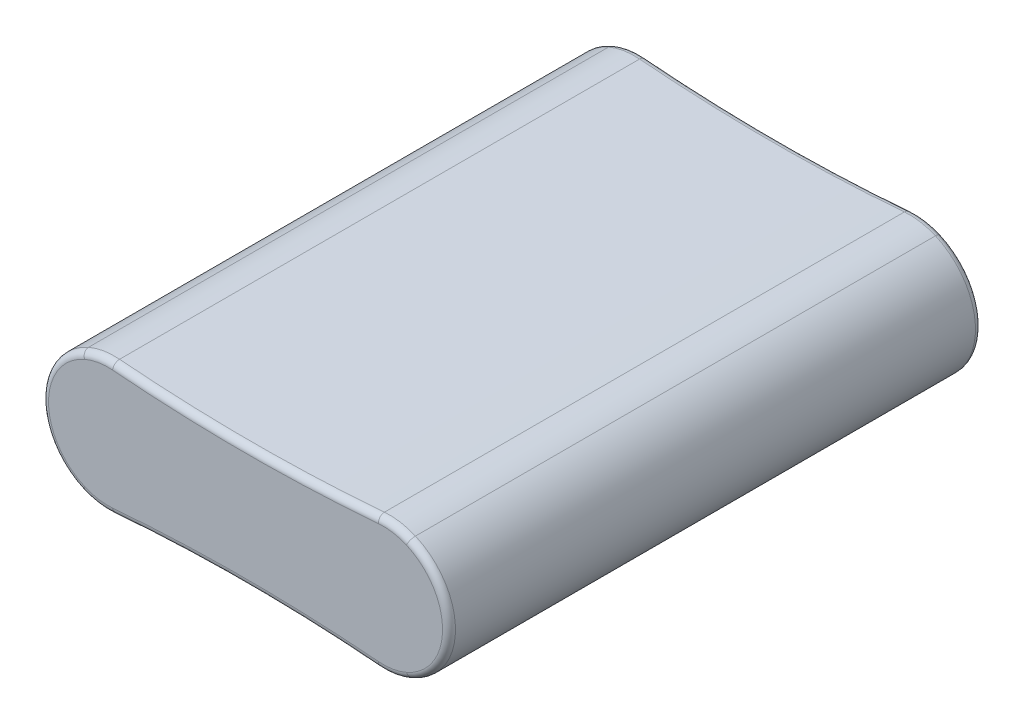
from build123d import *

# Parameters (mm, degrees)
BOSS_EXTRUDE1_DEPTH = 52.3875
FILLET1_R           = 12.7
FILLET2_R           = 1.27


with BuildPart() as part:
    # Sketch1 → Boss-Extrude1 (new, symmetric)
    with BuildSketch(Plane.XY):
        with BuildLine():
            ThreePointArc((-26.924, -13.081), (0, -11.938), (26.924, -13.081))
            ThreePointArc((26.924, -13.081), (40.005, 0), (26.924, 13.081))
            ThreePointArc((26.924, 13.081), (0, 11.938), (-26.924, 13.081))
            ThreePointArc((-26.924, 13.081), (-40.005, 0), (-26.924, -13.081))
        make_face()
    extrude(amount=BOSS_EXTRUDE1_DEPTH, both=True)

    # Fillet1
    # the kernel refuses this fillet: 12.7 mm, written as the material it takes off along each edge
    with BuildSketch(Plane(origin=(-26.924, 13.081, 65.711996683), x_dir=(-0.9790285886887711, -0.2037229062478567, 0), z_dir=(0, 0, -1)), Plane(origin=(-26.924, -13.081, -65.711996683), x_dir=(-0.9790285886887613, 0.20372290624790387, 0), z_dir=(0, 0, 1))) as fillet1_piece_1:
        with BuildLine():
            CenterArc((2.742517764, -12.433663076), FILLET1_R, 78.245250593, 28.210444168)
            ThreePointArc((-0.855059891, -0.253866895), (-0.427440847, -0.127233545), (0, 0))
            ThreePointArc((0, 0), (2.664899337, 0.274327031), (5.329798673, 0))
        make_face()
    extrude(amount=131.423993366, mode=Mode.SUBTRACT)
    with BuildSketch(Plane(origin=(26.924, 13.081, 65.711996683), x_dir=(-0.9965199988038926, -0.08335401600336978, 0), z_dir=(0, 0, -1))) as fillet1_piece_2:
        with BuildLine():
            CenterArc((0.909779676, -12.699987485), FILLET1_R, 90.08043566, 28.210444168)
            ThreePointArc((-5.109360575, -1.516966845), (-2.632759224, -0.495502435), (0, 0))
            ThreePointArc((0, 0), (0.445975285, -0.000313045), (0.891950569, 0))
        make_face()
    extrude(amount=131.423993366, mode=Mode.SUBTRACT)
    with BuildSketch(Plane(origin=(26.924, -13.081, -65.711996683), x_dir=(0.979028588688819, 0.20372290624762615, 0), z_dir=(0, 0, 1))) as fillet1_piece_3:
        with BuildLine():
            CenterArc((2.742517764, 12.433663076), FILLET1_R, 253.544305239, 28.210444168)
            ThreePointArc((-0.855059891, 0.253866895), (-0.427440847, 0.127233545), (0, 0))
            ThreePointArc((0, 0), (2.664899337, -0.274327031), (5.329798673, 0))
        make_face()
    extrude(amount=131.423993366, mode=Mode.SUBTRACT)

    # Fillet2
    fillet2_edges = [part.edges().sort_by_distance(p)[0] for p in [
        (40.005, 0, -52.3875),
        (40.005, 0, 52.3875),
        (-40.005, 0, -52.3875),
        (0, 11.938, -52.3875),
        (0, -11.938, -52.3875),
        (29.15115627, 12.878686287, -52.3875),
        (-29.15115627, 12.878686287, -52.3875),
        (-29.15115627, -12.878686287, -52.3875),
        (29.15115627, -12.878686287, -52.3875),
        (0, -11.938, 52.3875),
        (-40.005, 0, 52.3875),
        (0, 11.938, 52.3875),
        (29.15115627, 12.878686287, 52.3875),
        (-29.15115627, 12.878686287, 52.3875),
        (-29.15115627, -12.878686287, 52.3875),
        (29.15115627, -12.878686287, 52.3875),
    ]]
    fillet(fillet2_edges, radius=FILLET2_R)


solid = part.part
